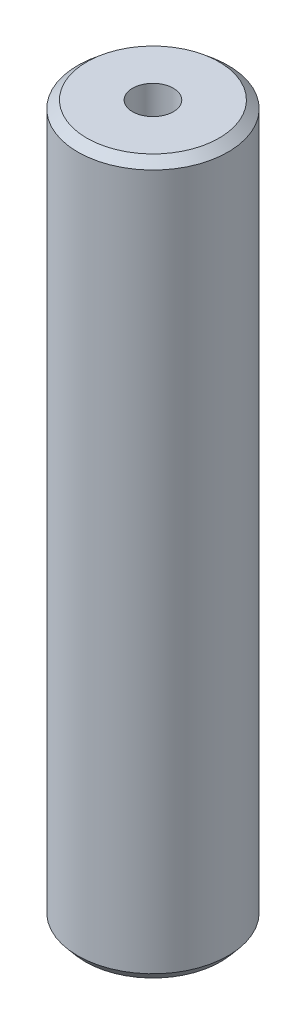
from build123d import *
from OCP.BRepFilletAPI import BRepFilletAPI_MakeChamfer

# Parameters (mm, degrees)
SKETCH1_R           = 7.5
BOSS_EXTRUDE1_DEPTH = 71.137254233
SKETCH2_R           = 2.036783561
CUT_EXTRUDE1_DEPTH  = 72.923632693
CHAMFER1_SIZE       = 0.754853958
CHAMFER1_SIZE2      = 0.899588545


with BuildPart() as part:
    # Sketch1 → Boss-Extrude1 (new body)
    with BuildSketch(Plane(origin=(0, 0, 0), x_dir=(1, 0, 0), z_dir=(0, 1, 0))):
        Circle(SKETCH1_R)
    extrude(amount=BOSS_EXTRUDE1_DEPTH)

    # Sketch2 → Cut-Extrude1 (cut, through all)
    with BuildSketch(Plane(origin=(0, 0, 0), x_dir=(1, 0, 0), z_dir=(0, 1, 0))):
        Circle(SKETCH2_R)
    extrude(amount=CUT_EXTRUDE1_DEPTH, mode=Mode.SUBTRACT)

    # Chamfer1: one chamfer whose edges measure the first distance from different faces: ONE call of the kernel's chamfer builder (chamfer() names one face for all edges)
    chamfer1_edges_1 = [part.edges().sort_by_distance(p)[0] for p in [
        (-7.5, 71.137254233, 0),
    ]]
    chamfer1_side_1 = [part.faces().sort_by_distance(p)[0] for p in [
        (-7.5, 35.568627116, 0),
    ]]
    chamfer1_edges_2 = [part.edges().sort_by_distance(p)[0] for p in [
        (-7.5, 0, 0),
    ]]
    chamfer1_side_2 = [part.faces().sort_by_distance(p)[0] for p in [
        (-7.287867966, 0, 0),
    ]]
    chamfer1 = BRepFilletAPI_MakeChamfer(part.part.solid().wrapped)
    for e in chamfer1_edges_1:
        chamfer1.Add(CHAMFER1_SIZE, CHAMFER1_SIZE2, e.wrapped, chamfer1_side_1[0].wrapped)  # the first distance lies on this face
    for e in chamfer1_edges_2:
        chamfer1.Add(CHAMFER1_SIZE, CHAMFER1_SIZE2, e.wrapped, chamfer1_side_2[0].wrapped)  # the first distance lies on this face
    add(Compound.cast(chamfer1.Shape()), mode=Mode.REPLACE)


solid = part.part
